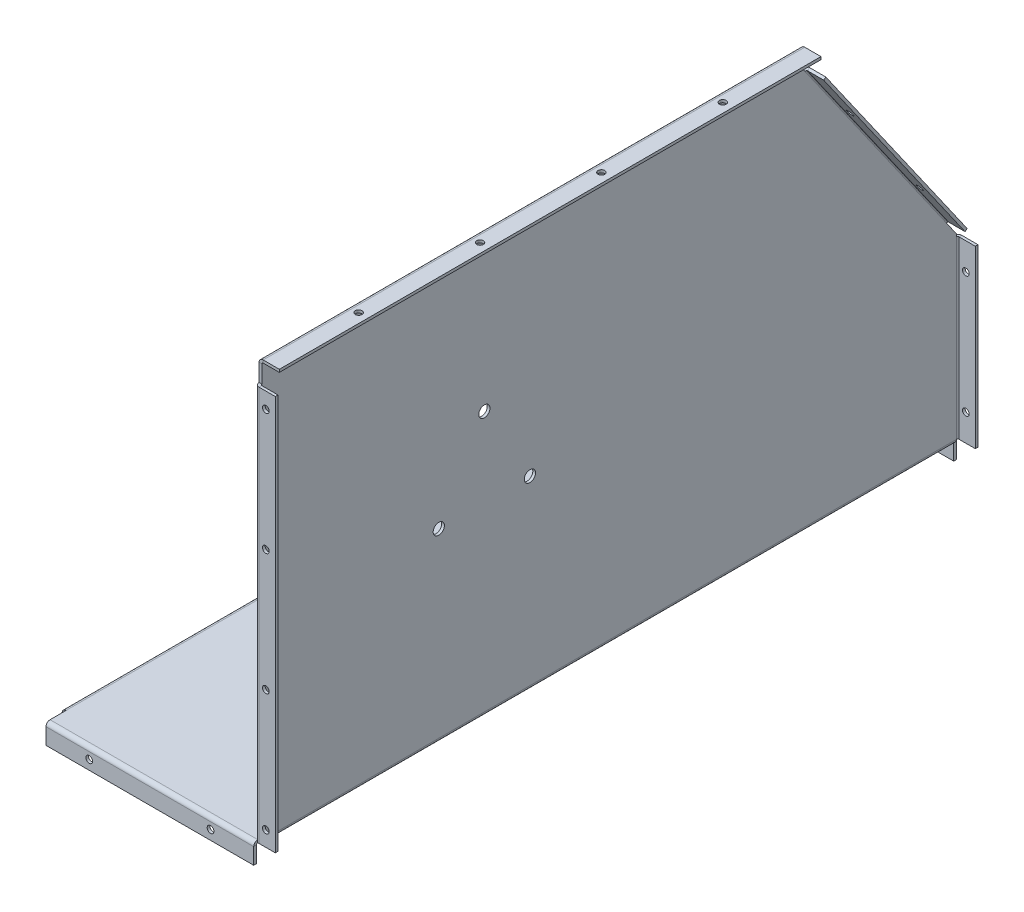
from build123d import *

# Parameters (mm, degrees)
EXTRUDE_1_DEPTH                  = 515
SHEET_METAL_1_OUTLINE_W          = 155
SHEET_METAL_1_OUTLINE_H          = 2
SHEET_METAL_1_DEPTH              = 515
SHEET_METAL_1_2_OUTLINE_W        = 2
SHEET_METAL_1_2_OUTLINE_H        = 154.141592654
SHEET_METAL_1_2_DEPTH            = 515
SHEET_METAL_1_3_DEPTH            = 515
SHEET_METAL_1_3_2_DEPTH          = 515
SM_EDGE_FLANGE_1_DEPTH           = 154
SM_EDGE_FLANGE_1_BEND_DEPTH      = 130
SM_EDGE_FLANGE_1_BEND_2_DEPTH    = 154
SM_EDGE_FLANGE_1_BEND_3_DEPTH    = 491
SM_START                         = 2
SM_EDGE_FLANGE_1_FLAT_DEPTH      = 2
SM_EDGE_FLANGE_1_BEND_4_DEPTH    = 293
CUT_EXTRUDE_1_REACH              = 626.01
SKETCH_21_R                      = 4.15
CUT_EXTRUDE_2_REACH              = 626.01
SM_EDGE_FLANGE_3_STRIP_W         = 10
SM_EDGE_FLANGE_3_STRIP_H         = 2
SM_EDGE_FLANGE_3_STRIP_CUT_DEPTH = 401.56637881
SM_EDGE_FLANGE_3_DEPTH           = 401.56637881
SM_EDGE_FLANGE_4_DEPTH           = 182.765483379
SKETCH_36_R                      = 2.5
CUT_EXTRUDE_2624_DEPTH           = 627.502194729
CUT_EXTRUDE_2823_REACH           = 628.502
SKETCH_38_R                      = 2.5
CUT_EXTRUDE_3033_REACH           = 661.366
SKETCH_39_R                      = 2.5
CUT_EXTRUDE_3335_REACH           = 628.502
SKETCH_40_R                      = 2.5
CUT_EXTRUDE_8_REACH              = 633.596
SKETCH_41_R                      = 2.5
CUT_EXTRUDE_4081_REACH           = 629.975
SKETCH_42_R                      = 3.25
CUT_EXTRUDE_10_REACH             = 627.006
SKETCH_43_R                      = 2.5


# Read off the part's stored shape, not the designer's step: Плоское состояние1, Согнутое состояние1
# Sheet-metal steps are written as plain solids
with BuildPart() as part:
    # Sketch 1 → Вытянуть-Тонкостенный1 (new body)
    with BuildSketch(Plane.XY):
        Polygon((-155, 0), (0, 0), (0, 310), (2, 310), (2, -2), (-155, -2), align=None)
    extrude(amount=EXTRUDE_1_DEPTH)

    # Sheet Metal 1 outline → Sheet Metal 1 (cut)
    with BuildSketch(Plane.XY):
        with Locations((-77.5, -1)):
            Rectangle(SHEET_METAL_1_OUTLINE_W, SHEET_METAL_1_OUTLINE_H)
    extrude(amount=SHEET_METAL_1_DEPTH, mode=Mode.SUBTRACT)

    # Sheet Metal 1 2 outline → Sheet Metal 1 2 (add)
    with BuildSketch(Plane.XY):
        with Locations((1, -79.070796327)):
            Rectangle(SHEET_METAL_1_2_OUTLINE_W, SHEET_METAL_1_2_OUTLINE_H)
    extrude(amount=SHEET_METAL_1_2_DEPTH)

    # Sheet Metal 1 3 outline → Sheet Metal 1 3 (cut)
    with BuildSketch(Plane.XY):
        with BuildLine():
            ThreePointArc((2, 1), (1.449489743, -0.732050808), (0, -1.828427125))
            Line((0, -1.828427125), (0, -156.141592654))
            Line((0, -156.141592654), (2, -156.141592654))
            Line((2, -156.141592654), (2, 1))
        make_face()
    extrude(amount=SHEET_METAL_1_3_DEPTH, mode=Mode.SUBTRACT)

    # Sheet Metal 1 3 2 outline → Sheet Metal 1 3 2 (add)
    with BuildSketch(Plane.XY):
        with BuildLine():
            Line((-1, 0), (-155, 0))
            Line((-155, 0), (-155, -2))
            Line((-155, -2), (-1, -2))
            ThreePointArc((-1, -2), (-0.492694064, -1.956795679), (0, -1.828427125))
            Line((0, -1.828427125), (0, 1))
            ThreePointArc((0, 1), (-0.292893219, 0.292893219), (-1, 0))
        make_face()
    extrude(amount=SHEET_METAL_1_3_2_DEPTH)

    # Ребро-кромка1 section (across the edge) → Ребро-кромка1 (add)
    with BuildSketch(Plane(origin=(-155, -2, -1), x_dir=(0, 0, 1), z_dir=(1, 0, 0))):
        with BuildLine():
            Line((-2, 1), (-2, 13))
            Line((-2, 13), (0, 13))
            Line((0, 13), (0, 1))
            ThreePointArc((0, 1), (0.292893219, 0.292893219), (1, 0))
            Line((1, 0), (1, -2))
            ThreePointArc((1, -2), (-1.121320344, -1.121320344), (-2, 1))
        make_face()
    extrude(amount=SM_EDGE_FLANGE_1_DEPTH)

    # Ребро-кромка1 section 2 (across the edge) → Ребро-кромка1 bend (add)
    with BuildSketch(Plane(origin=(2, 1, -1), x_dir=(0, 0, 1), z_dir=(0, 1, 0))):
        with BuildLine():
            Line((-2, 1), (-2, 13))
            Line((-2, 13), (0, 13))
            Line((0, 13), (0, 1))
            ThreePointArc((0, 1), (0.292893219, 0.292893219), (1, 0))
            Line((1, 0), (1, -2))
            ThreePointArc((1, -2), (-1.121320344, -1.121320344), (-2, 1))
        make_face()
    extrude(amount=SM_EDGE_FLANGE_1_BEND_DEPTH)

    # Ребро-кромка1 section 3 (across the edge) → Ребро-кромка1 bend 2 (add)
    with BuildSketch(Plane(origin=(-1, -2, 516), x_dir=(0, 0, -1), z_dir=(-1, 0, 0))):
        with BuildLine():
            Line((-2, 1), (-2, 13))
            Line((-2, 13), (0, 13))
            Line((0, 13), (0, 1))
            ThreePointArc((0, 1), (0.292893219, 0.292893219), (1, 0))
            Line((1, 0), (1, -2))
            ThreePointArc((1, -2), (-1.121320344, -1.121320344), (-2, 1))
        make_face()
    extrude(amount=SM_EDGE_FLANGE_1_BEND_2_DEPTH)

    # Ребро-кромка1 bend section (across the edge) → Ребро-кромка1 bend 3 (add)
    with BuildSketch(Plane(origin=(-156, -2, 503), x_dir=(1, 0, 0), z_dir=(0, 0, -1))):
        with BuildLine():
            Line((-2, 1), (0, 1))
            ThreePointArc((0, 1), (0.292893219, 0.292893219), (1, 0))
            Line((1, 0), (1, -2))
            ThreePointArc((1, -2), (-1.121320344, -1.121320344), (-2, 1))
        make_face()
    extrude(amount=SM_EDGE_FLANGE_1_BEND_3_DEPTH)

    # Ребро-кромка1 profile (on flange) → Ребро-кромка1 flat (add)
    with BuildSketch(Plane(origin=(-156, -2, 0), x_dir=(0, 0, -1), z_dir=(-1, 0, 0)).offset(SM_START)):
        Polygon((-503, 13), (-503, 1), (-12, 1), (-12, 8), (-17, 13), align=None)
    extrude(amount=-SM_EDGE_FLANGE_1_FLAT_DEPTH)

    # Ребро-кромка1 section 4 (across the edge) → Ребро-кромка1 bend 4 (add)
    with BuildSketch(Plane(origin=(2, 294, 516), x_dir=(0, 0, -1), z_dir=(0, -1, 0))):
        with BuildLine():
            Line((-2, 1), (-2, 13))
            Line((-2, 13), (0, 13))
            Line((0, 13), (0, 1))
            ThreePointArc((0, 1), (0.292893219, 0.292893219), (1, 0))
            Line((1, 0), (1, -2))
            ThreePointArc((1, -2), (-1.121320344, -1.121320344), (-2, 1))
        make_face()
    extrude(amount=SM_EDGE_FLANGE_1_BEND_4_DEPTH)

    # Эскиз21 → Вырез-Вытянуть1 (cut, up to next)
    with BuildSketch(Plane.ZY, mode=Mode.PRIVATE) as cut_extrude_1_sk1:
        with Locations((316.225009252, 135.5)):
            Circle(SKETCH_21_R)
    cut_extrude_1_tool1 = extrude(cut_extrude_1_sk1.sketch, amount=-CUT_EXTRUDE_1_REACH, mode=Mode.PRIVATE) & part.part
    # Эскиз21 → Вырез-Вытянуть1 (cut, up to next)
    with BuildSketch(Plane.ZY, mode=Mode.PRIVATE) as cut_extrude_1_sk2:
        with Locations((383.774990748, 135.5)):
            Circle(SKETCH_21_R)
    cut_extrude_1_tool2 = extrude(cut_extrude_1_sk2.sketch, amount=-CUT_EXTRUDE_1_REACH, mode=Mode.PRIVATE) & part.part
    # Эскиз21 → Вырез-Вытянуть1 (cut, up to next)
    with BuildSketch(Plane.ZY, mode=Mode.PRIVATE) as cut_extrude_1_sk3:
        with Locations((350, 194)):
            Circle(SKETCH_21_R)
    cut_extrude_1_tool3 = extrude(cut_extrude_1_sk3.sketch, amount=-CUT_EXTRUDE_1_REACH, mode=Mode.PRIVATE) & part.part
    add(cut_extrude_1_tool1.solids().sort_by_distance((0, 135.5, 316.225009))[0], mode=Mode.SUBTRACT)
    add(cut_extrude_1_tool2.solids().sort_by_distance((0, 135.5, 383.774991))[0], mode=Mode.SUBTRACT)
    add(cut_extrude_1_tool3.solids().sort_by_distance((0, 194, 350))[0], mode=Mode.SUBTRACT)

    # Эскиз22 → Вырез-Вытянуть2 (cut, up to next)
    with BuildSketch(Plane.ZY, mode=Mode.PRIVATE) as cut_extrude_2_sk1:
        Polygon((0, 133), (113.43362119, 295), (113.43362119, 310), (0, 310), align=None)
    cut_extrude_2_tool1 = extrude(cut_extrude_2_sk1.sketch, amount=-CUT_EXTRUDE_2_REACH, mode=Mode.PRIVATE) & part.part
    add(cut_extrude_2_tool1.solids().sort_by_distance((0, 250.609375, 40.765208))[0], mode=Mode.SUBTRACT)

    # Ребро-кромка3 strip (across the edge) → Ребро-кромка3 strip cut (cut)
    with BuildSketch(Plane(origin=(2, 310, 113.43362119), x_dir=(0, -1, 0), z_dir=(0, 0, 1))):
        with Locations((-2, -1)):
            Rectangle(SM_EDGE_FLANGE_3_STRIP_W, SM_EDGE_FLANGE_3_STRIP_H)
    extrude(amount=SM_EDGE_FLANGE_3_STRIP_CUT_DEPTH, mode=Mode.SUBTRACT)

    # Ребро-кромка3 section (across the edge) → Ребро-кромка3 (add)
    with BuildSketch(Plane(origin=(2, 310, 113.43362119), x_dir=(0, -1, 0), z_dir=(0, 0, 1))):
        with BuildLine():
            Line((0, 1), (0, 13))
            Line((0, 13), (2, 13))
            Line((2, 13), (2, 1))
            ThreePointArc((2, 1), (2.292893219, 0.292893219), (3, 0))
            Line((3, 0), (3, -2))
            ThreePointArc((3, -2), (0.878679656, -1.121320344), (0, 1))
        make_face()
    extrude(amount=SM_EDGE_FLANGE_3_DEPTH)

    # Ребро-кромка4 section (across the edge) → Ребро-кромка4 (add)
    with BuildSketch(Plane(origin=(2, 144.222553012, 6.637341628), x_dir=(3.4914813388431334e-15, -0.5735764363510413, 0.8191520442889951), z_dir=(0, 0.8191520442889951, 0.5735764363510413))):
        with BuildLine():
            Line((-2, 1), (-2, 13))
            Line((-2, 13), (0, 13))
            Line((0, 13), (0, 1))
            ThreePointArc((0, 1), (0.292893219, 0.292893219), (1, 0))
            Line((1, 0), (1, -2))
            ThreePointArc((1, -2), (-1.121320344, -1.121320344), (-2, 1))
        make_face()
    extrude(amount=SM_EDGE_FLANGE_4_DEPTH)

    # Эскиз36 → Cut-Extrude 2624 (cut, through all)
    with BuildSketch(Plane(origin=(0, 0, -3), x_dir=(-1, 0, 0), z_dir=(0, 0, -1))):
        with Locations(Location((33, -8, 0), (0, 0, 90))):
            Circle(SKETCH_36_R)
        with Locations(Location((123, -8, 0), (0, 0, 90))):
            Circle(SKETCH_36_R)
    extrude(amount=-CUT_EXTRUDE_2624_DEPTH, mode=Mode.SUBTRACT)

    # Эскиз38 → Cut-Extrude 2823 (cut, up to next)
    with BuildSketch(Plane(origin=(0, 0, -3), x_dir=(-1, 0, 0), z_dir=(0, 0, -1)), mode=Mode.PRIVATE) as cut_extrude_2823_sk1:
        with Locations((-8, 111)):
            Circle(SKETCH_38_R)
    cut_extrude_2823_tool1 = extrude(cut_extrude_2823_sk1.sketch, amount=-CUT_EXTRUDE_2823_REACH, mode=Mode.PRIVATE) & part.part
    # Эскиз38 → Cut-Extrude 2823 (cut, up to next)
    with BuildSketch(Plane(origin=(0, 0, -3), x_dir=(-1, 0, 0), z_dir=(0, 0, -1)), mode=Mode.PRIVATE) as cut_extrude_2823_sk2:
        with Locations((-8, 21)):
            Circle(SKETCH_38_R)
    cut_extrude_2823_tool2 = extrude(cut_extrude_2823_sk2.sketch, amount=-CUT_EXTRUDE_2823_REACH, mode=Mode.PRIVATE) & part.part
    add(cut_extrude_2823_tool1.solids().sort_by_distance((8, 111, -3))[0], mode=Mode.SUBTRACT)
    add(cut_extrude_2823_tool2.solids().sort_by_distance((8, 21, -3))[0], mode=Mode.SUBTRACT)

    # Эскиз39 → Cut-Extrude 3033 (cut, up to next)
    with BuildSketch(Plane(origin=(0, 45.476389778, -64.947015415), x_dir=(-1, 0, 0), z_dir=(-1.7489258850738628e-15, 0.5735764363510414, -0.8191520442889951)), mode=Mode.PRIVATE) as cut_extrude_3033_sk1:
        with Locations(Location((-8, 258.32996358, 0), (0, 0, 90))):
            Circle(SKETCH_39_R)
    cut_extrude_3033_tool1 = extrude(cut_extrude_3033_sk1.sketch, amount=-CUT_EXTRUDE_3033_REACH, mode=Mode.PRIVATE) & part.part
    # Эскиз39 → Cut-Extrude 3033 (cut, up to next)
    with BuildSketch(Plane(origin=(0, 45.476389778, -64.947015415), x_dir=(-1, 0, 0), z_dir=(-1.7489258850738628e-15, 0.5735764363510414, -0.8191520442889951)), mode=Mode.PRIVATE) as cut_extrude_3033_sk2:
        with Locations(Location((-8, 168.32996358, 0), (0, 0, 90))):
            Circle(SKETCH_39_R)
    cut_extrude_3033_tool2 = extrude(cut_extrude_3033_sk2.sketch, amount=-CUT_EXTRUDE_3033_REACH, mode=Mode.PRIVATE) & part.part
    add(cut_extrude_3033_tool1.solids().sort_by_distance((8, 257.087908, 83.224964))[0], mode=Mode.SUBTRACT)
    add(cut_extrude_3033_tool2.solids().sort_by_distance((8, 183.364224, 31.603085))[0], mode=Mode.SUBTRACT)

    # Эскиз40 → Cut-Extrude 3335 (cut, up to next)
    with BuildSketch(Plane.XY.offset(518), mode=Mode.PRIVATE) as cut_extrude_3335_sk1:
        with Locations((8, 282.292893219)):
            Circle(SKETCH_40_R)
    cut_extrude_3335_tool1 = extrude(cut_extrude_3335_sk1.sketch, amount=-CUT_EXTRUDE_3335_REACH, mode=Mode.PRIVATE) & part.part
    # Эскиз40 → Cut-Extrude 3335 (cut, up to next)
    with BuildSketch(Plane.XY.offset(518), mode=Mode.PRIVATE) as cut_extrude_3335_sk2:
        with Locations((8, 192.292893219)):
            Circle(SKETCH_40_R)
    cut_extrude_3335_tool2 = extrude(cut_extrude_3335_sk2.sketch, amount=-CUT_EXTRUDE_3335_REACH, mode=Mode.PRIVATE) & part.part
    # Эскиз40 → Cut-Extrude 3335 (cut, up to next)
    with BuildSketch(Plane.XY.offset(518), mode=Mode.PRIVATE) as cut_extrude_3335_sk3:
        with Locations((8, 102.292893219)):
            Circle(SKETCH_40_R)
    cut_extrude_3335_tool3 = extrude(cut_extrude_3335_sk3.sketch, amount=-CUT_EXTRUDE_3335_REACH, mode=Mode.PRIVATE) & part.part
    # Эскиз40 → Cut-Extrude 3335 (cut, up to next)
    with BuildSketch(Plane.XY.offset(518), mode=Mode.PRIVATE) as cut_extrude_3335_sk4:
        with Locations((8, 12.292893219)):
            Circle(SKETCH_40_R)
    cut_extrude_3335_tool4 = extrude(cut_extrude_3335_sk4.sketch, amount=-CUT_EXTRUDE_3335_REACH, mode=Mode.PRIVATE) & part.part
    add(cut_extrude_3335_tool1.solids().sort_by_distance((8, 282.292893, 518))[0], mode=Mode.SUBTRACT)
    add(cut_extrude_3335_tool2.solids().sort_by_distance((8, 192.292893, 518))[0], mode=Mode.SUBTRACT)
    add(cut_extrude_3335_tool3.solids().sort_by_distance((8, 102.292893, 518))[0], mode=Mode.SUBTRACT)
    add(cut_extrude_3335_tool4.solids().sort_by_distance((8, 12.292893, 518))[0], mode=Mode.SUBTRACT)

    # Эскиз41 → Вырез-Вытянуть8 (cut, up to next)
    with BuildSketch(Plane(origin=(0, 310, 0), x_dir=(1, 0, 0), z_dir=(0, 1, 0)), mode=Mode.PRIVATE) as cut_extrude_8_sk1:
        with Locations(Location((8, -449.216810595, 0), (0, 0, 180))):
            Circle(SKETCH_41_R)
    cut_extrude_8_tool1 = extrude(cut_extrude_8_sk1.sketch, amount=-CUT_EXTRUDE_8_REACH, mode=Mode.PRIVATE) & part.part
    # Эскиз41 → Вырез-Вытянуть8 (cut, up to next)
    with BuildSketch(Plane(origin=(0, 310, 0), x_dir=(1, 0, 0), z_dir=(0, 1, 0)), mode=Mode.PRIVATE) as cut_extrude_8_sk2:
        with Locations(Location((8, -359.216810595, 0), (0, 0, 180))):
            Circle(SKETCH_41_R)
    cut_extrude_8_tool2 = extrude(cut_extrude_8_sk2.sketch, amount=-CUT_EXTRUDE_8_REACH, mode=Mode.PRIVATE) & part.part
    # Эскиз41 → Вырез-Вытянуть8 (cut, up to next)
    with BuildSketch(Plane(origin=(0, 310, 0), x_dir=(1, 0, 0), z_dir=(0, 1, 0)), mode=Mode.PRIVATE) as cut_extrude_8_sk3:
        with Locations(Location((8, -269.216810595, 0), (0, 0, 180))):
            Circle(SKETCH_41_R)
    cut_extrude_8_tool3 = extrude(cut_extrude_8_sk3.sketch, amount=-CUT_EXTRUDE_8_REACH, mode=Mode.PRIVATE) & part.part
    # Эскиз41 → Вырез-Вытянуть8 (cut, up to next)
    with BuildSketch(Plane(origin=(0, 310, 0), x_dir=(1, 0, 0), z_dir=(0, 1, 0)), mode=Mode.PRIVATE) as cut_extrude_8_sk4:
        with Locations(Location((8, -179.216810595, 0), (0, 0, 180))):
            Circle(SKETCH_41_R)
    cut_extrude_8_tool4 = extrude(cut_extrude_8_sk4.sketch, amount=-CUT_EXTRUDE_8_REACH, mode=Mode.PRIVATE) & part.part
    add(cut_extrude_8_tool1.solids().sort_by_distance((8, 310, 449.216811))[0], mode=Mode.SUBTRACT)
    add(cut_extrude_8_tool2.solids().sort_by_distance((8, 310, 359.216811))[0], mode=Mode.SUBTRACT)
    add(cut_extrude_8_tool3.solids().sort_by_distance((8, 310, 269.216811))[0], mode=Mode.SUBTRACT)
    add(cut_extrude_8_tool4.solids().sort_by_distance((8, 310, 179.216811))[0], mode=Mode.SUBTRACT)

    # Эскиз42 → Cut-Extrude 4081 (cut, up to next)
    with BuildSketch(Plane.ZY.offset(158), mode=Mode.PRIVATE) as cut_extrude_4081_sk1:
        with Locations(Location((96.5, -9, 0), (0, 0, 270))):
            Circle(SKETCH_42_R)
    cut_extrude_4081_tool1 = extrude(cut_extrude_4081_sk1.sketch, amount=-CUT_EXTRUDE_4081_REACH, mode=Mode.PRIVATE) & part.part
    # Эскиз42 → Cut-Extrude 4081 (cut, up to next)
    with BuildSketch(Plane.ZY.offset(158), mode=Mode.PRIVATE) as cut_extrude_4081_sk2:
        with Locations(Location((456.5, -9, 0), (0, 0, 270))):
            Circle(SKETCH_42_R)
    cut_extrude_4081_tool2 = extrude(cut_extrude_4081_sk2.sketch, amount=-CUT_EXTRUDE_4081_REACH, mode=Mode.PRIVATE) & part.part
    # Эскиз42 → Cut-Extrude 4081 (cut, up to next)
    with BuildSketch(Plane.ZY.offset(158), mode=Mode.PRIVATE) as cut_extrude_4081_sk3:
        with Locations(Location((216.5, -9, 0), (0, 0, 270))):
            Circle(SKETCH_42_R)
    cut_extrude_4081_tool3 = extrude(cut_extrude_4081_sk3.sketch, amount=-CUT_EXTRUDE_4081_REACH, mode=Mode.PRIVATE) & part.part
    # Эскиз42 → Cut-Extrude 4081 (cut, up to next)
    with BuildSketch(Plane.ZY.offset(158), mode=Mode.PRIVATE) as cut_extrude_4081_sk4:
        with Locations(Location((336.5, -9, 0), (0, 0, 270))):
            Circle(SKETCH_42_R)
    cut_extrude_4081_tool4 = extrude(cut_extrude_4081_sk4.sketch, amount=-CUT_EXTRUDE_4081_REACH, mode=Mode.PRIVATE) & part.part
    add(cut_extrude_4081_tool1.solids().sort_by_distance((-158, -9, 96.5))[0], mode=Mode.SUBTRACT)
    add(cut_extrude_4081_tool2.solids().sort_by_distance((-158, -9, 456.5))[0], mode=Mode.SUBTRACT)
    add(cut_extrude_4081_tool3.solids().sort_by_distance((-158, -9, 216.5))[0], mode=Mode.SUBTRACT)
    add(cut_extrude_4081_tool4.solids().sort_by_distance((-158, -9, 336.5))[0], mode=Mode.SUBTRACT)

    # Эскиз43 → Вырез-Вытянуть10 (cut, up to next)
    with BuildSketch(Plane.XZ.offset(2), mode=Mode.PRIVATE) as cut_extrude_10_sk1:
        with Locations(Location((-47, 410, 0), (0, 0, 270))):
            Circle(SKETCH_43_R)
    cut_extrude_10_tool1 = extrude(cut_extrude_10_sk1.sketch, amount=-CUT_EXTRUDE_10_REACH, mode=Mode.PRIVATE) & part.part
    # Эскиз43 → Вырез-Вытянуть10 (cut, up to next)
    with BuildSketch(Plane.XZ.offset(2), mode=Mode.PRIVATE) as cut_extrude_10_sk2:
        with Locations(Location((-11, 410, 0), (0, 0, 270))):
            Circle(SKETCH_43_R)
    cut_extrude_10_tool2 = extrude(cut_extrude_10_sk2.sketch, amount=-CUT_EXTRUDE_10_REACH, mode=Mode.PRIVATE) & part.part
    add(cut_extrude_10_tool1.solids().sort_by_distance((-47, -2, 410))[0], mode=Mode.SUBTRACT)
    add(cut_extrude_10_tool2.solids().sort_by_distance((-11, -2, 410))[0], mode=Mode.SUBTRACT)


solid = part.part
